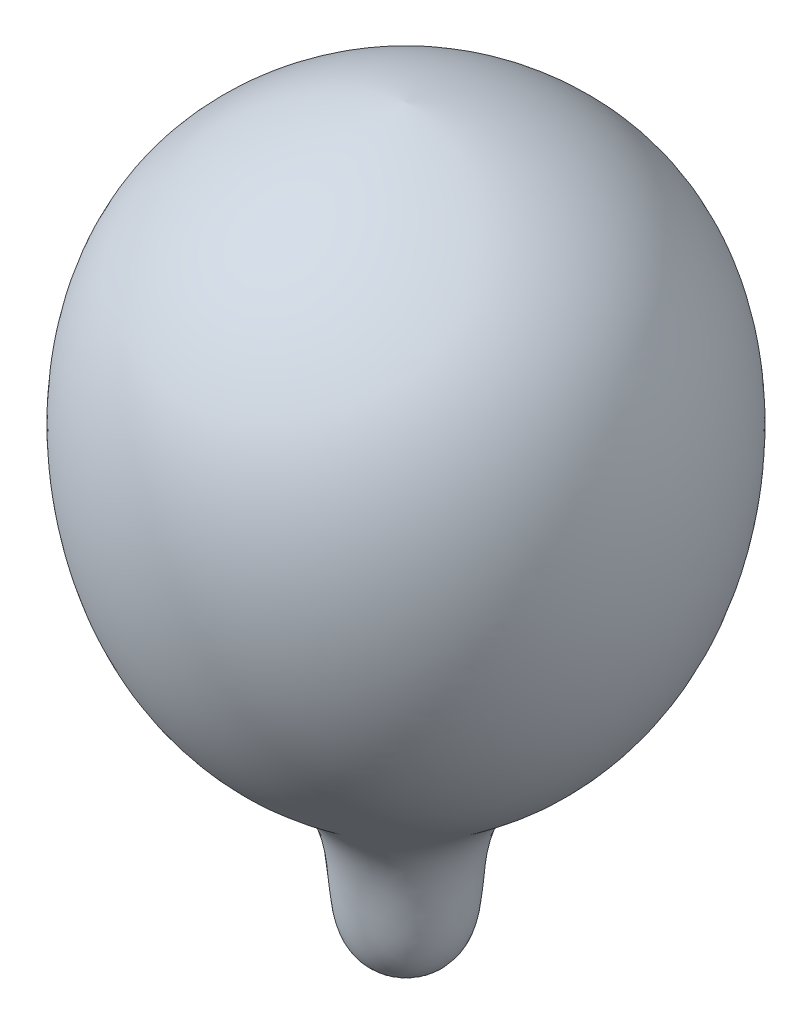
from build123d import *


with BuildPart() as part:
    # Sketch1 → Revolve1 (revolve)
    with BuildSketch(Plane.XY):
        with BuildLine():
            add(Edge.make_bspline(
                [(0, 154.376673304), (50.789597848, 148.745853307), (146.201275618, 104.544566869), (170.121497955, 9.311753072), (170.121497713, -31.8982874)],
                knots=[0, 0, 0, 0, 0.244025511, 0.426511035, 0.426511035, 0.426511035, 0.426511035], degree=3))
            Line((0, 154.376673304), (0, -347.294734483))
            add(Edge.make_bspline(
                [(170.121497713, -31.8982874), (170.121497608, -49.76614669), (163.046889144, -115.788021516), (121.334705065, -195.770219444), (45.771564324, -239.569847756), (33.817219819, -300.68829119), (37.702453763, -340.34617196), (0, -347.294734483)],
                knots=[0.426511035, 0.426511035, 0.426511035, 0.426511035, 0.505633153, 0.717447363, 0.831783835, 0.876368215, 1, 1, 1, 1], degree=3))
        make_face()
    revolve(axis=Axis((0, 154.376673304, 0), (0, -1, 0)))


solid = part.part
